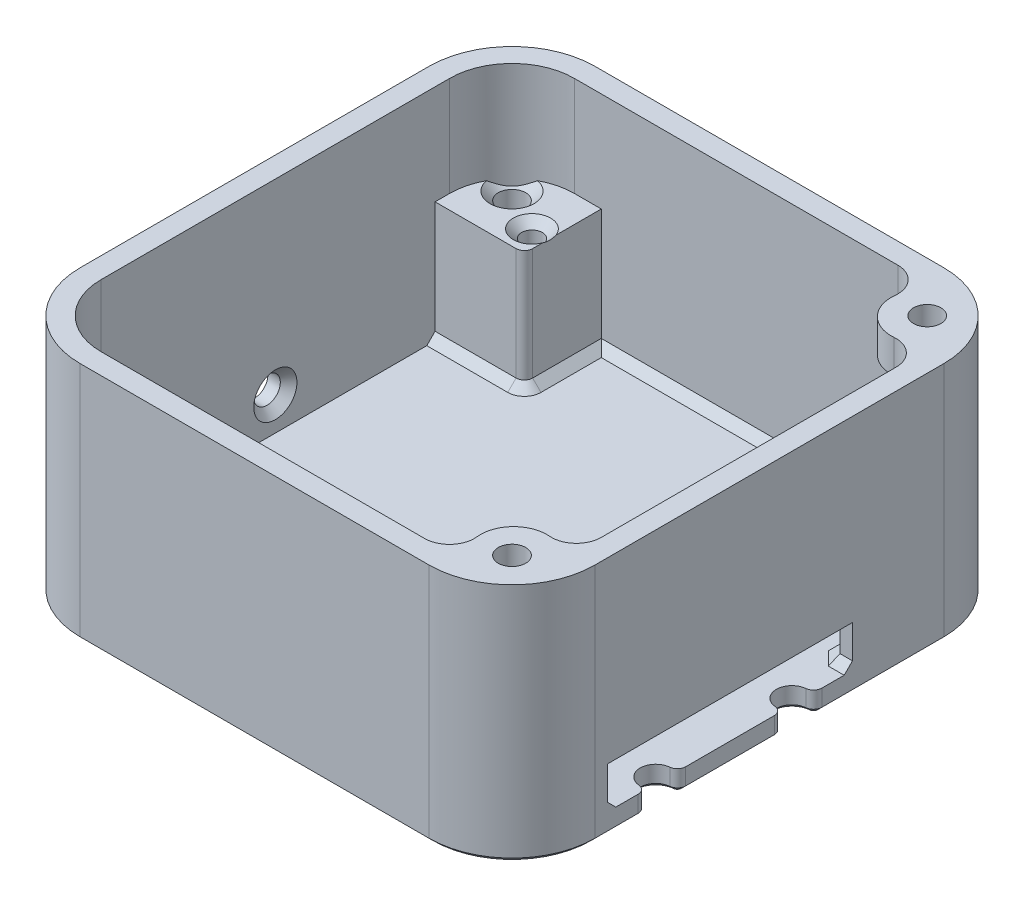
from build123d import *

# Parameters (mm, degrees)
CROQUIS1_W              = 62
CROQUIS1_H              = 62
SALIENTE_EXTRUIR1_DEPTH = 29
REDONDEO1_R             = 10
REDONDEO2_R             = 10
VACIADO1_T              = -2.5
SALIENTE_EXTRUIR2_DEPTH = 2.5
CROQUIS6_W              = 29.5
CROQUIS6_H              = 5
CORTAR_EXTRUIR4_DEPTH   = 10
CROQUIS7_R              = 1.6
CORTAR_EXTRUIR5_DEPTH   = 10
SALIENTE_EXTRUIR3_DEPTH = 14.5
CROQUIS9_R              = 1.25
CORTAR_EXTRUIR6_DEPTH   = 14
REDONDEO3_R             = 1
CROQUIS10_R             = 4
SALIENTE_EXTRUIR4_DEPTH = 4
REDONDEO4_R             = 3
CROQUIS11_R             = 1.65
CORTAR_EXTRUIR7_DEPTH   = 11
CROQUIS12_R             = 1.65
CORTAR_EXTRUIR8_DEPTH   = 72.37226352
CHAFL_N1_SIZE           = 1
CHAFL_N2_SIZE           = 1
CHAFL_N3_SIZE           = 1
CROQUIS14_R             = 1.875
CORTAR_EXTRUIR10_DEPTH  = 4
REDONDEO6_R             = 1
CHAFL_N4_SIZE           = 1
CHAFL_N5_SIZE           = 1
CHAFL_N6_SIZE           = 0.5


with BuildPart() as part:
    # Croquis1 → Saliente-Extruir1 (new body)
    with BuildSketch(Plane(origin=(0, 0, 0), x_dir=(1, 0, 0), z_dir=(0, 1, 0))):
        with Locations((31, 0)):
            Rectangle(CROQUIS1_W, CROQUIS1_H)
    extrude(amount=SALIENTE_EXTRUIR1_DEPTH)

    # Redondeo1
    redondeo1_edges = [part.edges().sort_by_distance(p)[0] for p in [
        (62, 14.5, -31),
        (62, 14.5, 31),
    ]]
    fillet(redondeo1_edges, radius=REDONDEO1_R)

    # Redondeo2
    redondeo2_edges = [part.edges().sort_by_distance(p)[0] for p in [
        (0, 14.5, -31),
        (0, 14.5, 31),
    ]]
    fillet(redondeo2_edges, radius=REDONDEO2_R)

    # Vaciado1
    vaciado1_openings = [part.faces().sort_by_distance(p)[0] for p in [
        (31, 29, 0),
        (31, 0, 0),
    ]]
    offset(amount=VACIADO1_T, openings=vaciado1_openings, kind=Kind.INTERSECTION)

    # Croquis4 → Saliente-Extruir2 (add)
    with BuildSketch(Plane.XZ):
        with BuildLine():
            Line((7.5, 28.5), (54.5, 28.5))
            ThreePointArc((54.5, 28.5), (58.035533906, 27.035533906), (59.5, 23.5))
            Line((59.5, 23.5), (59.5, -23.5))
            ThreePointArc((59.5, -23.5), (58.035533906, -27.035533906), (54.5, -28.5))
            Line((54.5, -28.5), (7.5, -28.5))
            ThreePointArc((7.5, -28.5), (3.964466094, -27.035533906), (2.5, -23.5))
            Line((2.5, -23.5), (2.5, 23.5))
            ThreePointArc((2.5, 23.5), (3.964466094, 27.035533906), (7.5, 28.5))
        make_face()
    extrude(amount=-SALIENTE_EXTRUIR2_DEPTH)

    # Croquis6 → Cortar-Extruir4 (cut)
    with BuildSketch(Plane(origin=(62, 0, 0), x_dir=(0, 0, -1), z_dir=(1, 0, 0))):
        with Locations((-4.75, 5)):
            Rectangle(CROQUIS6_W, CROQUIS6_H)
    extrude(amount=-CORTAR_EXTRUIR4_DEPTH, mode=Mode.SUBTRACT)

    # Croquis7 → Cortar-Extruir5 (cut)
    with BuildSketch(Plane.ZY):
        with Locations((0, 6.5)):
            Circle(CROQUIS7_R)
    extrude(amount=-CORTAR_EXTRUIR5_DEPTH, mode=Mode.SUBTRACT)

    # Croquis8 → Saliente-Extruir3 (add)
    with BuildSketch(Plane(origin=(0, 2.5, 0), x_dir=(1, 0, 0), z_dir=(0, 1, 0))):
        with BuildLine():
            Line((7.5, 28.5), (13.25, 28.5))
            Line((13.25, 28.5), (13.25, 19.238533402))
            Line((13.25, 19.238533402), (2.5, 19.238533402))
            Line((2.5, 19.238533402), (2.5, 23.5))
            ThreePointArc((2.5, 23.5), (3.964466094, 27.035533906), (7.5, 28.5))
        make_face()
        with BuildLine():
            Line((54.5, 28.5), (53.5, 28.5))
            Line((53.5, 28.5), (53.5, 19.5))
            Line((53.5, 19.5), (59.5, 19.5))
            Line((59.5, 19.5), (59.5, 23.5))
            ThreePointArc((59.5, 23.5), (58.035533906, 27.035533906), (54.5, 28.5))
        make_face()
        with BuildLine():
            Line((53.5, -28.5), (53.5, -19.5))
            Line((53.5, -19.5), (59.5, -19.5))
            Line((59.5, -19.5), (59.5, -23.5))
            ThreePointArc((59.5, -23.5), (58.035533906, -27.035533906), (54.5, -28.5))
            Line((54.5, -28.5), (53.5, -28.5))
        make_face()
        with BuildLine():
            Line((13.25, -28.5), (13.25, -19.238533402))
            Line((13.25, -19.238533402), (2.5, -19.238533402))
            Line((2.5, -19.238533402), (2.5, -23.5))
            ThreePointArc((2.5, -23.5), (3.964466094, -27.035533906), (7.5, -28.5))
            Line((7.5, -28.5), (13.25, -28.5))
        make_face()
    extrude(amount=SALIENTE_EXTRUIR3_DEPTH)

    # Croquis9 → Cortar-Extruir6 (cut)
    with BuildSketch(Plane(origin=(0, 17, 0), x_dir=(1, 0, 0), z_dir=(0, 1, 0))):
        with Locations(Location((11.150789858, 22.25, 0), (0, 0, 270))):
            Circle(CROQUIS9_R)
        with Locations(Location((11.150789858, -22.25, 0), (0, 0, 270))):
            Circle(CROQUIS9_R)
        with Locations(Location((55.650789858, -22.25, 0), (0, 0, 270))):
            Circle(CROQUIS9_R)
        with Locations(Location((55.650789858, 22.25, 0), (0, 0, 270))):
            Circle(CROQUIS9_R)
    extrude(amount=-CORTAR_EXTRUIR6_DEPTH, mode=Mode.SUBTRACT)

    # Redondeo3
    redondeo3_edges = [part.edges().sort_by_distance(p)[0] for p in [
        (13.25, 9.75, -19.238533402),
        (53.5, 9.75, -19.5),
        (53.5, 9.75, 19.5),
        (13.25, 9.75, 19.238533402),
    ]]
    fillet(redondeo3_edges, radius=REDONDEO3_R)

    # Croquis10 → Saliente-Extruir4 (add)
    with BuildSketch(Plane(origin=(0, 29, 0), x_dir=(1, 0, 0), z_dir=(0, 1, 0))):
        with Locations((55.92749759, 24.724875841)):
            Circle(CROQUIS10_R)
        with Locations((55.92749759, -24.724875841)):
            Circle(CROQUIS10_R)
    extrude(amount=-SALIENTE_EXTRUIR4_DEPTH)

    # Redondeo4
    # the kernel refuses this fillet: 3 mm, written as the material it adds along each edge
    with BuildSketch(Plane(origin=(53.998281473, 25, 28.22889142), x_dir=(-0.9985493395159579, 0, 0.0538443734501969), z_dir=(0, 1, 0))) as redondeo4_piece_1:
        with BuildLine():
            CenterArc((4.873506998, -2.995648019), REDONDEO4_R, 86.913451995, 96.35751518)
            Line((1.878394426, -3.166822443), (1.578883169, -3.183939885))
            ThreePointArc((1.578883169, -3.183939885), (1.067214214, -1.507478192), (-0.158631675, -0.254629126))
            Line((-0.158631675, -0.254629126), (-0.064245901, 0.293040039))
            ThreePointArc((-0.064245901, 0.293040039), (2.026133629, 0.462683882), (5.05119343, 0.299564802))
            Line((5.05119343, 0.299564802), (5.035040118, 0))
        make_face()
    extrude(amount=4)
    with BuildSketch(Plane(origin=(59.324510179, 25, 22.612932312), x_dir=(0.03605137766851697, 0, -0.999349937793665), z_dir=(0, 1, 0))) as redondeo4_piece_2:
        with BuildLine():
            CenterArc((4.759616053, 2.998049813), REDONDEO4_R, 177.374803647, 94.691235843)
            Line((1.76276448, 3.135456684), (1.463079322, 3.149197372))
            ThreePointArc((1.463079322, 3.149197372), (0.992200514, 1.505425929), (-0.167477821, 0.248899938))
            Line((-0.167477821, 0.248899938), (-0.053913005, -0.295115889))
            ThreePointArc((-0.053913005, -0.295115889), (1.629025869, -0.417032291), (4.878585599, -0.299804981))
            Line((4.878585599, -0.299804981), (4.867770186, 0))
        make_face()
    extrude(amount=4)
    with BuildSketch(Plane(origin=(59.324510179, 25, -22.612932312), x_dir=(0.036051377668516946, 0, 0.999349937793665), z_dir=(0, 1, 0))) as redondeo4_piece_3:
        with BuildLine():
            CenterArc((4.759616053, -2.998049813), REDONDEO4_R, 87.93396051, 94.691235843)
            Line((1.76276448, -3.135456684), (1.463079322, -3.149197372))
            ThreePointArc((1.463079322, -3.149197372), (0.992200514, -1.505425929), (-0.167477821, -0.248899938))
            Line((-0.167477821, -0.248899938), (-0.053913005, 0.295115889))
            ThreePointArc((-0.053913005, 0.295115889), (1.629025869, 0.417032291), (4.878585599, 0.299804981))
            Line((4.878585599, 0.299804981), (4.867770186, 0))
        make_face()
    extrude(amount=4)
    with BuildSketch(Plane(origin=(53.998281473, 25, -28.22889142), x_dir=(-0.9985493395159579, 0, -0.05384437345019698), z_dir=(0, 1, 0))) as redondeo4_piece_4:
        with BuildLine():
            CenterArc((4.873506998, 2.995648019), REDONDEO4_R, 176.729032825, 96.35751518)
            Line((1.878394426, 3.166822443), (1.578883169, 3.183939885))
            ThreePointArc((1.578883169, 3.183939885), (1.067214214, 1.507478192), (-0.158631675, 0.254629126))
            Line((-0.158631675, 0.254629126), (-0.064245901, -0.293040039))
            ThreePointArc((-0.064245901, -0.293040039), (2.026133629, -0.462683882), (5.05119343, -0.299564802))
            Line((5.05119343, -0.299564802), (5.035040118, 0))
        make_face()
    extrude(amount=4)

    # Croquis11 → Cortar-Extruir7 (cut)
    with BuildSketch(Plane(origin=(0, 29, 0), x_dir=(1, 0, 0), z_dir=(0, 1, 0))):
        with Locations((6, 25)):
            Circle(CROQUIS11_R)
        with Locations((6, -25)):
            Circle(CROQUIS11_R)
        with Locations(Location((56, -25, 0), (0, 0, 270))):
            Circle(CROQUIS11_R)
        with Locations(Location((56, 25, 0), (0, 0, 270))):
            Circle(CROQUIS11_R)
    extrude(amount=-CORTAR_EXTRUIR7_DEPTH, mode=Mode.SUBTRACT)

    # Croquis12 → Cortar-Extruir8 (cut, through all)
    with BuildSketch(Plane(origin=(0, 17, 0), x_dir=(1, 0, 0), z_dir=(0, 1, 0))):
        with Locations(Location((6, 25, 0), (0, 0, 270))):
            Circle(CROQUIS12_R)
        with Locations(Location((6, -25, 0), (0, 0, 270))):
            Circle(CROQUIS12_R)
    extrude(amount=-CORTAR_EXTRUIR8_DEPTH, mode=Mode.SUBTRACT)

    # Chaflán1
    # the kernel refuses this chamfer: 1 mm, written as the material it takes off along each edge
    with BuildSketch(Plane(origin=(6, 17, -25), x_dir=(0, 0, 1), z_dir=(-1, 0, 0))) as chafl_n1_piece_1_section:
        Polygon((1.65 + CHAFL_N1_SIZE, 0), (1.65, -CHAFL_N1_SIZE), (1.65, 0), align=None)
    chafl_n1_piece_1 = revolve(axis=Axis((6, 17, -25), (0, 1, 0)), mode=Mode.PRIVATE)
    chafl_n1_piece_1 = chafl_n1_piece_1 & Plane(origin=(10, 16.512844588, -21), x_dir=(0, 0, -1), z_dir=(0, 1, 0)) * Cylinder(7.5, 11, mode=Mode.PRIVATE)
    add(chafl_n1_piece_1, mode=Mode.SUBTRACT)
    with BuildSketch(Plane(origin=(6, 17, 25), x_dir=(0, 0, 1), z_dir=(-1, 0, 0))) as chafl_n1_piece_2_section:
        Polygon((1.65 + CHAFL_N1_SIZE, 0), (1.65, -CHAFL_N1_SIZE), (1.65, 0), align=None)
    chafl_n1_piece_2 = revolve(axis=Axis((6, 17, 25), (0, 1, 0)), mode=Mode.PRIVATE)
    chafl_n1_piece_2 = chafl_n1_piece_2 & Plane(origin=(10, 16.512844566, 21), x_dir=(-1, 0, 0), z_dir=(0, 1, 0)) * Cylinder(7.5, 11, mode=Mode.PRIVATE)
    add(chafl_n1_piece_2, mode=Mode.SUBTRACT)

    # Chaflán2
    # the kernel refuses this chamfer: 1 mm, written as the material it takes off along each edge
    with BuildSketch(Plane(origin=(55.650789858, 17, -22.25), x_dir=(0, 0, 1), z_dir=(-1, 0, 0))) as chafl_n2_piece_1:
        Polygon((1.25 + CHAFL_N2_SIZE, 0), (1.25, -CHAFL_N2_SIZE), (1.25, 0), align=None)
    revolve(axis=Axis((55.650789858, 17, -22.25), (0, 1, 0)), mode=Mode.SUBTRACT)
    with BuildSketch(Plane(origin=(55.650789858, 17, 22.25), x_dir=(0, 0, 1), z_dir=(-1, 0, 0))) as chafl_n2_piece_2:
        Polygon((1.25 + CHAFL_N2_SIZE, 0), (1.25, -CHAFL_N2_SIZE), (1.25, 0), align=None)
    revolve(axis=Axis((55.650789858, 17, 22.25), (0, 1, 0)), mode=Mode.SUBTRACT)
    with BuildSketch(Plane(origin=(11.150789858, 17, 22.25), x_dir=(0, 0, 1), z_dir=(-1, 0, 0))) as chafl_n2_piece_3:
        Polygon((1.25 + CHAFL_N2_SIZE, 0), (1.25, -CHAFL_N2_SIZE), (1.25, 0), align=None)
    revolve(axis=Axis((11.150789858, 17, 22.25), (0, 1, 0)), mode=Mode.SUBTRACT)
    with BuildSketch(Plane(origin=(11.150789858, 17, -22.25), x_dir=(0, 0, 1), z_dir=(-1, 0, 0))) as chafl_n2_piece_4:
        Polygon((1.25 + CHAFL_N2_SIZE, 0), (1.25, -CHAFL_N2_SIZE), (1.25, 0), align=None)
    revolve(axis=Axis((11.150789858, 17, -22.25), (0, 1, 0)), mode=Mode.SUBTRACT)

    # Chaflán3
    chafl_n3_edges = [part.edges().sort_by_distance(p)[0] for p in [
        (59.5, 7.5, 4.75),
        (59.5, 5, -10),
    ]]
    chamfer(chafl_n3_edges, length=CHAFL_N3_SIZE)

    # Croquis14 → Cortar-Extruir10 (cut)
    with BuildSketch(Plane.XZ):
        with Locations((61.261779527, 12.95)):
            Circle(CROQUIS14_R)
        with Locations((61.261779527, -3.45)):
            Circle(CROQUIS14_R)
    extrude(amount=-CORTAR_EXTRUIR10_DEPTH, mode=Mode.SUBTRACT)

    # Redondeo6
    redondeo6_edges = [part.edges().sort_by_distance(p)[0] for p in [
        (62, 1.25, -1.726441027),
        (62, 1.25, -5.173558973),
        (62, 1.25, 14.673558973),
        (62, 1.25, 11.226441027),
    ]]
    fillet(redondeo6_edges, radius=REDONDEO6_R)

    # Chaflán4
    chafl_n4_edges = [part.edges().sort_by_distance(p)[0] for p in [
        (2.5, 6.5, -1.6),
    ]]
    chamfer(chafl_n4_edges, length=CHAFL_N4_SIZE)

    # Chaflán5
    chafl_n5_edges = [part.edges().sort_by_distance(p)[0] for p in [
        (32.625, 2.5, -28.5),
        (7.375, 2.5, -19.238533402),
        (52.753817215, 2.5, -28.462021148),
        (59.5, 2.5, -15.25),
        (53.5, 2.5, -24.424234614),
        (13.25, 2.5, 24.369266701),
        (53.5, 2.5, 24.424234614),
        (58.25, 2.5, 19.5),
        (7.375, 2.5, 19.238533402),
        (13.25, 2.5, -24.369266701),
        (57, 2.5, -19.5),
        (53.792893219, 2.5, 19.792893219),
        (12.957106781, 2.5, 19.531426621),
        (12.957106781, 2.5, -19.531426621),
        (53.792893219, 2.5, -19.792893219),
        (61.25, 2.5, -10),
        (60, 2.5, -10.5),
        (32.625, 2.5, 28.5),
        (52.753817215, 2.5, 28.462021148),
    ]]
    chamfer(chafl_n5_edges, length=CHAFL_N5_SIZE)

    # Chaflán6
    chafl_n6_edges = [part.edges().sort_by_distance(p)[0] for p in [
        (31, 0, -31),
        (62, 0, 18.406528596),
        (59.071067812, 0, 28.071067812),
        (59.071067812, 0, -28.071067812),
        (31, 0, 31),
        (0, 0, 0),
        (2.928932188, 0, -28.071067812),
        (2.928932188, 0, 28.071067812),
        (62, 0, 4.75),
        (59.386779527, 0, -3.45),
        (59.386779527, 0, 12.95),
        (62, 0, -13.656528596),
        (61.738597911, 0, 10.761089029),
        (61.738597911, 0, 15.138910971),
        (61.738597911, 0, -5.638910971),
        (61.738597911, 0, -1.261089029),
    ]]
    chamfer(chafl_n6_edges, length=CHAFL_N6_SIZE)


solid = part.part
